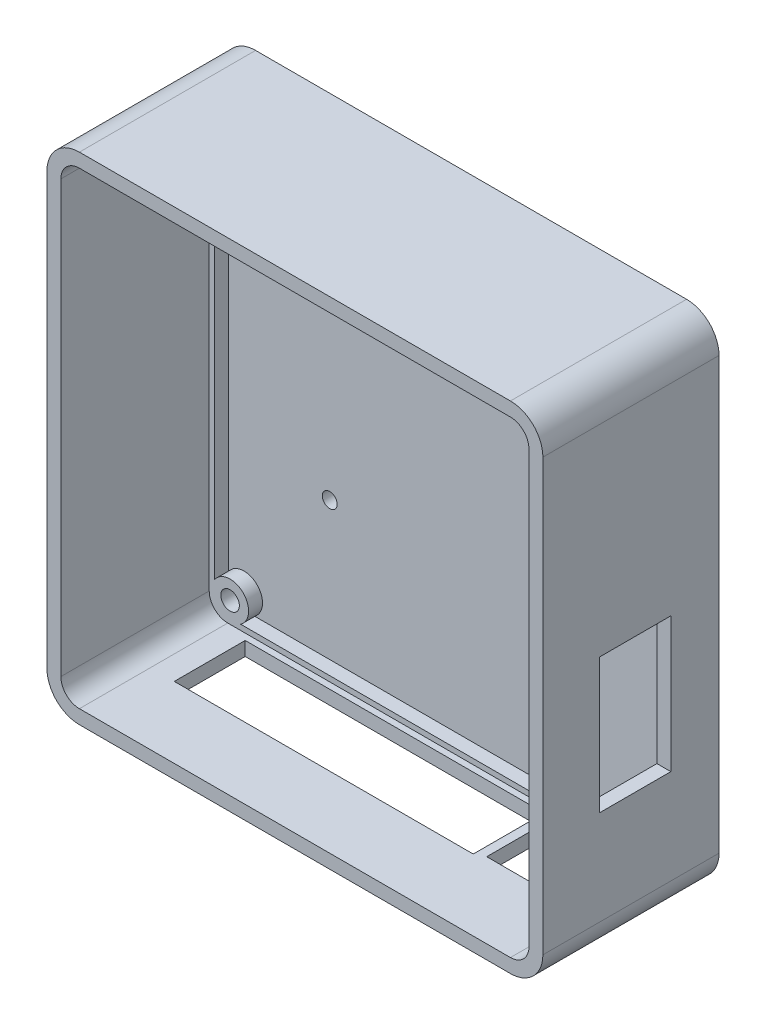
from build123d import *

# Parameters (mm, degrees)
SCHIZZO1_W                        = 100.974800609
SCHIZZO1_H                        = 100.97480061
ESTRUSIONE_ESTRUSIONE1_DEPTH      = 3
SCHIZZO3_R                        = 2
TAGLIO_ESTRUSIONE1_DEPTH          = 10
RACCORDO1_R                       = 4
TAGLIO_ESTRUSIONE2_DEPTH          = 3
ESTRUSIONE_ESTRUSIONE2_DEPTH      = 32
ESTRUSIONE_ESTRUSIONE2_DEPTH_BACK = 3
ESTRUSIONE_ESTRUSIONE3_START      = 3
ESTRUSIONE_ESTRUSIONE3_DEPTH      = 3
TAGLIO_ESTRUSIONE3_REACH          = 187.694
SCHIZZO7_W                        = 16.242748833
SCHIZZO7_H                        = 14.432058418
SCHIZZO7_W_2                      = 64.496064987
SCHIZZO7_H_2                      = 15.3
TAGLIO_ESTRUSIONE4_REACH          = 177.413
SCHIZZO8_W                        = 15.4
SCHIZZO8_H                        = 29.105346697
SMUSSO1_SIZE                      = 3
SCHIZZO9_R                        = 2
SCHIZZO9_R_2                      = 1.85551968
TAGLIO_ESTRUSIONE5_DEPTH          = 108.867451135
SCHIZZO10_R                       = 1.6
TAGLIO_ESTRUSIONE6_DEPTH          = 5


with BuildPart() as part:
    # Schizzo1 → Estrusione-Estrusione1 (new body)
    with BuildSketch(Plane(origin=(0, 0, 94.00326253), x_dir=(-1, 0, 0), z_dir=(0, 0, -1))):
        with Locations((31.141269188, 5.2439824)):
            Rectangle(SCHIZZO1_W, SCHIZZO1_H)
    extrude(amount=ESTRUSIONE_ESTRUSIONE1_DEPTH)

    # Schizzo3 → Taglio-Estrusione1 (cut)
    with BuildSketch(Plane.XY.offset(94.00326253)):
        with Locations((-77.128669492, 51.231382705)):
            Circle(SCHIZZO3_R)
        with Locations((14.871330508, 51.231382705)):
            Circle(SCHIZZO3_R)
        with Locations((-77.128669492, -40.768617295)):
            Circle(SCHIZZO3_R)
        with Locations((14.871330508, -40.768617295)):
            Circle(SCHIZZO3_R)
    extrude(amount=-TAGLIO_ESTRUSIONE1_DEPTH, mode=Mode.SUBTRACT)

    # Raccordo1
    raccordo1_edges = [part.edges().sort_by_distance(p)[0] for p in [
        (19.346131117, 55.731382705, 92.50326253),
        (-81.628669492, 55.731382705, 92.50326253),
        (-81.628669492, -45.243417905, 92.50326253),
        (19.346131117, -45.243417905, 92.50326253),
    ]]
    fillet(raccordo1_edges, radius=RACCORDO1_R)

    # Schizzo4 → Taglio-Estrusione2 (cut)
    with BuildSketch(Plane.XY.offset(94.00326253)):
        with BuildLine():
            Line((-74.872857768, -44.07184503), (12.615518783, -44.07184503))
            ThreePointArc((12.615518783, -44.07184503), (12.042903383, -37.940190171), (18.174558242, -38.512805571))
            Line((18.174558242, -38.512805571), (18.174558242, 48.97557098))
            ThreePointArc((18.174558242, 48.97557098), (12.027018614, 48.418930065), (12.652868681, 54.559809829))
            Line((12.652868681, 54.559809829), (-74.910207666, 54.559809829))
            ThreePointArc((-74.910207666, 54.559809829), (-74.300242368, 48.40295558), (-80.457096617, 49.012920878))
            Line((-80.457096617, 49.012920878), (-80.457096617, -38.550155469))
            ThreePointArc((-80.457096617, -38.550155469), (-74.316216853, -37.924305402), (-74.872857768, -44.07184503))
        make_face()
    extrude(amount=-TAGLIO_ESTRUSIONE2_DEPTH, mode=Mode.SUBTRACT)

    # Schizzo5 → Estrusione-Estrusione2 (add, two sides: drawn at the far end of the back side and taken through both)
    with BuildSketch(Plane.XY.offset(94.00326253).offset(-ESTRUSIONE_ESTRUSIONE2_DEPTH_BACK)):
        with BuildLine():
            Line((-77.628669492, 58.731382705), (15.346131117, 58.731382705))
            ThreePointArc((15.346131117, 58.731382705), (20.295878585, 56.681130173), (22.346131117, 51.731382705))
            Line((22.346131117, 51.731382705), (22.346131117, -41.243417905))
            ThreePointArc((22.346131117, -41.243417905), (20.295878585, -46.193165373), (15.346131117, -48.243417905))
            Line((15.346131117, -48.243417905), (-77.628669492, -48.243417905))
            ThreePointArc((-77.628669492, -48.243417905), (-82.578416961, -46.193165373), (-84.628669492, -41.243417905))
            Line((-84.628669492, -41.243417905), (-84.628669492, 51.731382705))
            ThreePointArc((-84.628669492, 51.731382705), (-82.578416961, 56.681130173), (-77.628669492, 58.731382705))
        make_face()
        with BuildLine():
            Line((-77.628669492, 55.731382705), (15.346131117, 55.731382705))
            ThreePointArc((15.346131117, 55.731382705), (18.174558242, 54.559809829), (19.346131117, 51.731382705))
            Line((19.346131117, 51.731382705), (19.346131117, -41.243417905))
            ThreePointArc((19.346131117, -41.243417905), (18.174558242, -44.07184503), (15.346131117, -45.243417905))
            Line((15.346131117, -45.243417905), (-77.628669492, -45.243417905))
            ThreePointArc((-77.628669492, -45.243417905), (-80.457096617, -44.07184503), (-81.628669492, -41.243417905))
            Line((-81.628669492, -41.243417905), (-81.628669492, 51.731382705))
            ThreePointArc((-81.628669492, 51.731382705), (-80.457096617, 54.559809829), (-77.628669492, 55.731382705))
        make_face(mode=Mode.SUBTRACT)
    extrude(amount=ESTRUSIONE_ESTRUSIONE2_DEPTH + ESTRUSIONE_ESTRUSIONE2_DEPTH_BACK)

    # Schizzo6 → Estrusione-Estrusione3 (add)
    with BuildSketch(Plane(origin=(0, 0, 91.00326253), x_dir=(-1, 0, 0), z_dir=(0, 0, -1)).offset(ESTRUSIONE_ESTRUSIONE3_START)):
        with BuildLine():
            Line((-15.346131117, 58.731382705), (77.628669492, 58.731382705))
            ThreePointArc((77.628669492, 58.731382705), (82.578416961, 56.681130173), (84.628669492, 51.731382705))
            Line((84.628669492, 51.731382705), (84.628669492, -41.243417905))
            ThreePointArc((84.628669492, -41.243417905), (82.578416961, -46.193165373), (77.628669492, -48.243417905))
            Line((77.628669492, -48.243417905), (-15.346131117, -48.243417905))
            ThreePointArc((-15.346131117, -48.243417905), (-20.295878585, -46.193165373), (-22.346131117, -41.243417905))
            Line((-22.346131117, -41.243417905), (-22.346131117, 51.731382705))
            ThreePointArc((-22.346131117, 51.731382705), (-20.295878585, 56.681130173), (-15.346131117, 58.731382705))
        make_face()
    extrude(amount=-ESTRUSIONE_ESTRUSIONE3_DEPTH)

    # Schizzo7 → Taglio-Estrusione3 (cut, up to next)
    with BuildSketch(Plane.XZ.offset(48.243417905), mode=Mode.PRIVATE) as taglio_estrusione3_sk1:
        with Locations((2.075800916, 102.505448711)):
            Rectangle(SCHIZZO7_W, SCHIZZO7_H)
    taglio_estrusione3_tool1 = extrude(taglio_estrusione3_sk1.sketch, amount=-TAGLIO_ESTRUSIONE3_REACH, mode=Mode.PRIVATE) & part.part
    # Schizzo7 → Taglio-Estrusione3 (cut, up to next)
    with BuildSketch(Plane.XZ.offset(48.243417905), mode=Mode.PRIVATE) as taglio_estrusione3_sk2:
        with Locations((-40.245307891, 103.027287944)):
            Rectangle(SCHIZZO7_W_2, SCHIZZO7_H_2)
    taglio_estrusione3_tool2 = extrude(taglio_estrusione3_sk2.sketch, amount=-TAGLIO_ESTRUSIONE3_REACH, mode=Mode.PRIVATE) & part.part
    add(taglio_estrusione3_tool1.solids().sort_by_distance((2.075801, -48.243418, 102.505449))[0], mode=Mode.SUBTRACT)
    add(taglio_estrusione3_tool2.solids().sort_by_distance((-40.245308, -48.243418, 103.027288))[0], mode=Mode.SUBTRACT)

    # Schizzo8 → Taglio-Estrusione4 (cut, up to next)
    with BuildSketch(Plane(origin=(22.346131117, 0, 0), x_dir=(0, 0, -1), z_dir=(1, 0, 0)), mode=Mode.PRIVATE) as taglio_estrusione4_sk1:
        with Locations((-106.101551061, -6.264379468)):
            Rectangle(SCHIZZO8_W, SCHIZZO8_H)
    taglio_estrusione4_tool1 = extrude(taglio_estrusione4_sk1.sketch, amount=-TAGLIO_ESTRUSIONE4_REACH, mode=Mode.PRIVATE) & part.part
    add(taglio_estrusione4_tool1.solids().sort_by_distance((22.346131, -6.264379, 106.101551))[0], mode=Mode.SUBTRACT)

    # Smusso1
    smusso1_edges = [part.edges().sort_by_distance(p)[0] for p in [
        (2.075800916, -48.243417905, 95.289419502),
    ]]
    chamfer(smusso1_edges, length=SMUSSO1_SIZE - 0.0001)  # a hair under: the kernel refuses the full size

    # Schizzo9 → Taglio-Estrusione5 (cut, through all)
    with BuildSketch(Plane.XY.offset(94.00326253)):
        with Locations((-77.128669492, 51.231382705)):
            Circle(SCHIZZO9_R)
        with Locations((14.871330508, 51.231382705)):
            Circle(SCHIZZO9_R_2)
        with Locations((14.871330508, -40.768617295)):
            Circle(SCHIZZO9_R)
        with Locations((-77.128669492, -40.768617295)):
            Circle(SCHIZZO9_R)
    extrude(amount=-TAGLIO_ESTRUSIONE5_DEPTH, mode=Mode.SUBTRACT)

    # Schizzo10 → Taglio-Estrusione6 (cut)
    with BuildSketch(Plane(origin=(0, 0, 88.00326253), x_dir=(-1, 0, 0), z_dir=(0, 0, -1))):
        with Locations((3.653868883, 31.731382705)):
            Circle(SCHIZZO10_R)
        with Locations((3.653868883, -14.268617295)):
            Circle(SCHIZZO10_R)
        with Locations((58.628669492, -14.268617295)):
            Circle(SCHIZZO10_R)
        with Locations((58.628669492, 31.731382705)):
            Circle(SCHIZZO10_R)
    extrude(amount=-TAGLIO_ESTRUSIONE6_DEPTH, mode=Mode.SUBTRACT)


solid = part.part
